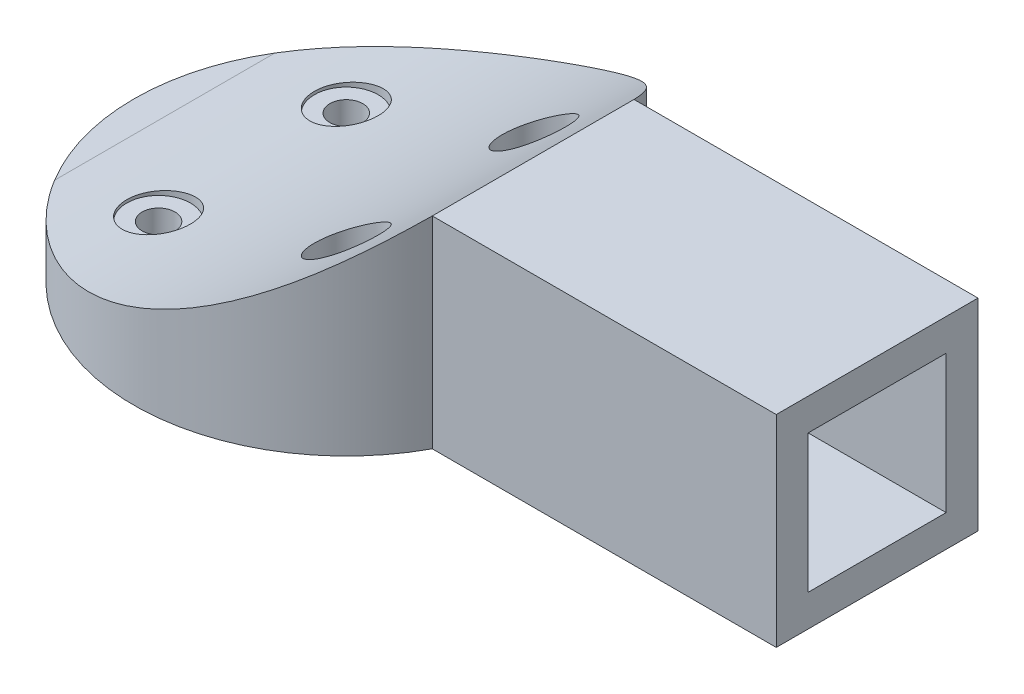
from build123d import *

# Parameters (mm, degrees)
BOSS_EXTRUDE1_DEPTH     = 2.5
SKETCH2_R               = 1.55
CUT_EXTRUDE1_DEPTH      = 2.5
SKETCH6_W               = 19
SKETCH6_H               = 19
BOSS_EXTRUDE3_DEPTH     = 32.400284093
SKETCH8_W               = 13
SKETCH8_H               = 13
CUT_EXTRUDE2_DEPTH      = 27.400284093
FILLET2_R               = 50
CUT_EXTRUDE4_REACH      = 57.642
CUT_EXTRUDE4_END_RADIUS = 50
SKETCH13_R              = 3


with BuildPart() as part:
    # Sketch1 → Boss-Extrude1 (new, symmetric)
    with BuildSketch(Plane(origin=(0, 0, 0), x_dir=(1, 0, 0), z_dir=(0, 1, 0))):
        with BuildLine():
            Line((17.599715907, 9.5), (50, 9.5))
            Line((50, 9.5), (50, -9.5))
            Line((50, -9.5), (17.599715907, -9.5))
            ThreePointArc((17.599715907, -9.5), (-20, 0), (17.599715907, 9.5))
        make_face()
    extrude(amount=BOSS_EXTRUDE1_DEPTH, both=True)

    # Sketch2 → Cut-Extrude1 (cut, symmetric)
    with BuildSketch(Plane(origin=(0, 0, 0), x_dir=(1, 0, 0), z_dir=(0, 1, 0))):
        with Locations(Location((8.838834765, 8.838834765, 0), (0, 0, 270))):
            Circle(SKETCH2_R)
        with Locations(Location((-8.838834765, 8.838834765, 0), (0, 0, 270))):
            Circle(SKETCH2_R)
        with Locations(Location((-8.838834765, -8.838834765, 0), (0, 0, 270))):
            Circle(SKETCH2_R)
        with Locations(Location((8.838834765, -8.838834765, 0), (0, 0, 270))):
            Circle(SKETCH2_R)
    extrude(amount=CUT_EXTRUDE1_DEPTH, both=True, mode=Mode.SUBTRACT)

    # Sketch6 → Boss-Extrude3 (add)
    with BuildSketch(Plane(origin=(50, 0, 0), x_dir=(0, 0, -1), z_dir=(1, 0, 0))):
        with Locations((0, 7)):
            Rectangle(SKETCH6_W, SKETCH6_H)
    extrude(amount=-BOSS_EXTRUDE3_DEPTH)

    # Sketch8 → Cut-Extrude2 (cut)
    with BuildSketch(Plane(origin=(50, 0, 0), x_dir=(0, 0, -1), z_dir=(1, 0, 0))):
        with Locations((0, 7)):
            Rectangle(SKETCH8_W, SKETCH8_H)
    extrude(amount=-CUT_EXTRUDE2_DEPTH, mode=Mode.SUBTRACT)

    # Fillet2
    # the kernel refuses this fillet: 50 mm, written as the material it adds along each edge
    with BuildSketch(Plane(origin=(17.599715907, 2.5, -96.246757864), x_dir=(-1, 0, 0), z_dir=(0, 0, 1))) as fillet2_piece_1_section:
        with BuildLine():
            CenterArc((34.698703146, -50), FILLET2_R, 90, 43.945519562)
            Line((0, -14), (0, 0))
            Line((0, 0), (34.698703146, 0))
        make_face()
    fillet2_piece_1 = extrude(amount=192.493515729, mode=Mode.PRIVATE)
    fillet2_piece_1 = fillet2_piece_1 & Plane(origin=(0, 2.5, 0), x_dir=(0.8799857953399021, 0, 0.47500000000000003), z_dir=(0, 1, 0)) * Cylinder(20, 524, mode=Mode.PRIVATE)
    fillet2_piece_1 = fillet2_piece_1 - Plane(origin=(8.838834765, 2.5, 8.838834765), x_dir=(0, 0, 1), z_dir=(0, 1, 0)) * Cylinder(1.55, 524, mode=Mode.PRIVATE)
    fillet2_piece_1 = fillet2_piece_1 - Plane(origin=(-8.838834765, 2.5, 8.838834765), x_dir=(0, 0, 1), z_dir=(0, 1, 0)) * Cylinder(1.55, 524, mode=Mode.PRIVATE)
    fillet2_piece_1 = fillet2_piece_1 - Plane(origin=(8.838834765, 2.5, -8.838834765), x_dir=(0, 0, 1), z_dir=(0, 1, 0)) * Cylinder(1.55, 524, mode=Mode.PRIVATE)
    fillet2_piece_1 = fillet2_piece_1 - Plane(origin=(-8.838834765, 2.5, -8.838834765), x_dir=(0, 0, 1), z_dir=(0, 1, 0)) * Cylinder(1.55, 524, mode=Mode.PRIVATE)
    add(fillet2_piece_1)

    # Cut-Extrude4: up to this cylinder (the profile starts outside it)
    cut_extrude4_end = Plane(origin=(-17.098987239, 52.5, 0), z_dir=(0, 0, -1)) * Cylinder(CUT_EXTRUDE4_END_RADIUS, 233.96167, mode=Mode.PRIVATE)
    # Sketch13 → Cut-Extrude4 (cut, up to the surface)
    with BuildSketch(Plane(origin=(0, 2.5, 0), x_dir=(1, 0, 0), z_dir=(0, 1, 0)), mode=Mode.PRIVATE) as cut_extrude4_sk1:
        with Locations(Location((-8.838834765, 8.838834765, 0), (0, 0, 90))):
            Circle(SKETCH13_R)
    cut_extrude4_tool1 = extrude(cut_extrude4_sk1.sketch, amount=CUT_EXTRUDE4_REACH, mode=Mode.PRIVATE) - cut_extrude4_end
    add(cut_extrude4_tool1.solids().sort_by_distance((-8.838835, 2.5, -8.838835))[0], mode=Mode.SUBTRACT)
    # Sketch13 → Cut-Extrude4 (cut, up to the surface)
    with BuildSketch(Plane(origin=(0, 2.5, 0), x_dir=(1, 0, 0), z_dir=(0, 1, 0)), mode=Mode.PRIVATE) as cut_extrude4_sk2:
        with Locations(Location((8.838834765, 8.838834765, 0), (0, 0, 90))):
            Circle(SKETCH13_R)
    cut_extrude4_tool2 = extrude(cut_extrude4_sk2.sketch, amount=CUT_EXTRUDE4_REACH, mode=Mode.PRIVATE) - cut_extrude4_end
    add(cut_extrude4_tool2.solids().sort_by_distance((8.838835, 2.5, -8.838835))[0], mode=Mode.SUBTRACT)
    # Sketch13 → Cut-Extrude4 (cut, up to the surface)
    with BuildSketch(Plane(origin=(0, 2.5, 0), x_dir=(1, 0, 0), z_dir=(0, 1, 0)), mode=Mode.PRIVATE) as cut_extrude4_sk3:
        with Locations(Location((-8.838834765, -8.838834765, 0), (0, 0, 90))):
            Circle(SKETCH13_R)
    cut_extrude4_tool3 = extrude(cut_extrude4_sk3.sketch, amount=CUT_EXTRUDE4_REACH, mode=Mode.PRIVATE) - cut_extrude4_end
    add(cut_extrude4_tool3.solids().sort_by_distance((-8.838835, 2.5, 8.838835))[0], mode=Mode.SUBTRACT)
    # Sketch13 → Cut-Extrude4 (cut, up to the surface)
    with BuildSketch(Plane(origin=(0, 2.5, 0), x_dir=(1, 0, 0), z_dir=(0, 1, 0)), mode=Mode.PRIVATE) as cut_extrude4_sk4:
        with Locations(Location((8.838834765, -8.838834765, 0), (0, 0, 90))):
            Circle(SKETCH13_R)
    cut_extrude4_tool4 = extrude(cut_extrude4_sk4.sketch, amount=CUT_EXTRUDE4_REACH, mode=Mode.PRIVATE) - cut_extrude4_end
    add(cut_extrude4_tool4.solids().sort_by_distance((8.838835, 2.5, 8.838835))[0], mode=Mode.SUBTRACT)


solid = part.part
